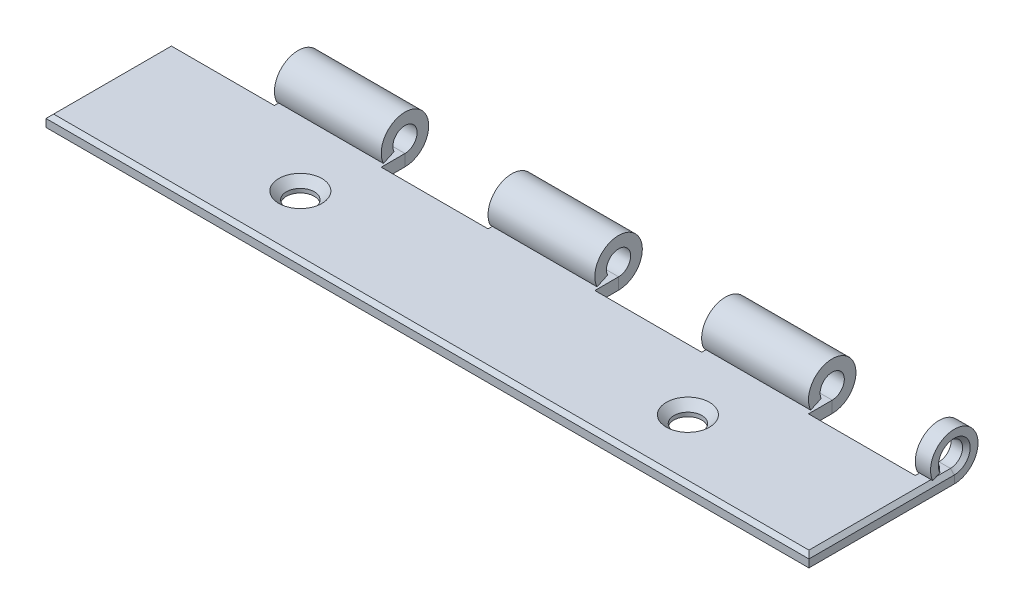
from build123d import *

# Parameters (mm, degrees)
SKETCH1_W          = 100
SKETCH1_H          = 22.1615
BASE_FLANGE1_DEPTH = 1.524
HEM1_START         = -50
HEM1_DEPTH         = 100
HEM1_2_DEPTH       = 100
CUT_EXTRUDE1_START = -52.42823759
SKETCH8_W          = 14
SKETCH8_H          = 6.223
CUT_EXTRUDE1_DEPTH = 94.856475179
LPATTERN1_COUNT    = 11
LPATTERN1_PITCH    = 28
CHAMFER1_SIZE      = 0.5
SKETCH9_R          = 1.8288
CUT_EXTRUDE2_DEPTH = 10
LPATTERN2_COUNT    = 6
LPATTERN2_PITCH    = 50.8
CHAMFER2_SIZE      = 1


# Read off the part's stored shape, not the designer's step: Hem1
# Sheet-metal steps are written as plain solids
with BuildPart() as part:
    # Sketch1 → Base-Flange1 (new body)
    with BuildSketch(Plane(origin=(0, 0, 0), x_dir=(1, 0, 0), z_dir=(0, 1, 0))):
        Rectangle(SKETCH1_W, SKETCH1_H)
    extrude(amount=-BASE_FLANGE1_DEPTH)

    # Hem1 outline → Hem1 (cut)
    with BuildSketch(Plane.YZ.offset(HEM1_START)):
        with BuildLine():
            Line((0, -11.08075), (0, -10.645306054))
            ThreePointArc((0, -10.645306054), (-1.116287945, -9.509043168), (-1.524, -7.96925))
            Line((-1.524, -7.96925), (-1.524, -11.08075))
            Line((-1.524, -11.08075), (0, -11.08075))
        make_face()
    extrude(amount=HEM1_DEPTH, mode=Mode.SUBTRACT)

    # Hem1 2 outline → Hem1 2 (add)
    with BuildSketch(Plane.YZ.offset(HEM1_START)):
        with BuildLine():
            Line((0.272523279, -5.149273321), (0.916593509, -6.530486388))
            ThreePointArc((0.916593509, -6.530486388), (2.92638392, -8.822213128), (0, -7.96925))
            Line((0, -7.96925), (0, -10.645306054))
            ThreePointArc((0, -10.645306054), (4.69518189, -8.123345818), (0.272523279, -5.149273321))
        make_face()
    extrude(amount=HEM1_2_DEPTH)

    # Sketch8 → Cut-Extrude1 (cut)
    with BuildSketch(Plane(origin=(0, 0, 0), x_dir=(1, 0, 0), z_dir=(0, 1, 0)).offset(CUT_EXTRUDE1_START)):
        with Locations((-43, 7.96925)):
            Rectangle(SKETCH8_W, SKETCH8_H)
    cut_extrude1 = extrude(amount=CUT_EXTRUDE1_DEPTH, mode=Mode.SUBTRACT)

    # LPattern1: Cut-Extrude1 ×11
    with Locations(*[(i * LPATTERN1_PITCH, 0, 0) for i in range(1, LPATTERN1_COUNT)]):
        add(cut_extrude1, mode=Mode.SUBTRACT)

    # Chamfer1
    chamfer1_edges = [part.edges().sort_by_distance(p)[0] for p in [
        (50, 2.92638392, -8.822213128),
        (-50, 0, 3.1115),
        (0, 0, 11.08075),
        (50, 0, 1.55575),
    ]]
    chamfer(chamfer1_edges, length=CHAMFER1_SIZE)

    # Sketch9 → Cut-Extrude2 (cut)
    with BuildSketch(Plane(origin=(0, 0, 0), x_dir=(1, 0, 0), z_dir=(0, 1, 0))):
        with Locations(Location((-24.6, -3.14325, 0), (0, 0, 270))):
            Circle(SKETCH9_R)
    cut_extrude2 = extrude(amount=-CUT_EXTRUDE2_DEPTH, mode=Mode.SUBTRACT)

    # LPattern2: Cut-Extrude2 ×6
    with Locations(*[(i * LPATTERN2_PITCH, 0, 0) for i in range(1, LPATTERN2_COUNT)]):
        add(cut_extrude2, mode=Mode.SUBTRACT)

    # Chamfer2
    chamfer2_edges = [part.edges().sort_by_distance(p)[0] for p in [
        (-24.6, 0, 1.31445),
        (26.2, 0, 1.31445),
    ]]
    chamfer(chamfer2_edges, length=CHAMFER2_SIZE)


solid = part.part
